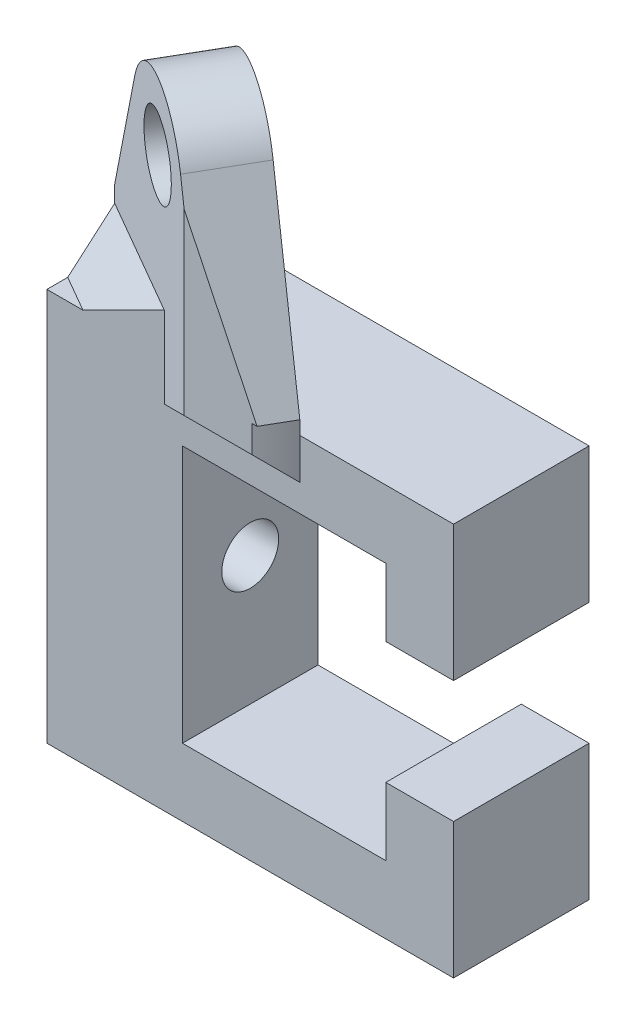
from build123d import *

# Parameters (mm, degrees)
BOSS_EXTRUDE1_DEPTH = 5
SKETCH2_R           = 2.1
CUT_EXTRUDE1_DEPTH  = 10
SKETCH3_R           = 10
BOSS_EXTRUDE2_DEPTH = 1
SKETCH4_R           = 2.75
BOSS_EXTRUDE3_DEPTH = 5
SKETCH5_W           = 50
SKETCH5_H           = 30
SKETCH5_W_2         = 34
SKETCH5_H_2         = 14
CUT_EXTRUDE2_DEPTH  = 52.14684741
CUT_EXTRUDE3_START  = -1
CUT_EXTRUDE3_DEPTH  = 1
CUT_EXTRUDE4_START  = -1
CUT_EXTRUDE4_DEPTH  = 1
CHAMFER1_SIZE       = 3
CHAMFER2_SIZE       = 3
SKETCH8_W           = 10.980685111
SKETCH8_H           = 18.946061275
CUT_EXTRUDE5_DEPTH  = 51.645829048
BOSS_EXTRUDE4_DEPTH = 1


with BuildPart() as part:
    # Sketch1 → Boss-Extrude1 (new, symmetric)
    with BuildSketch(Plane.XY):
        Polygon((15, 5), (15, 0), (0, 0), (0, 19), (15, 19), (15, 14), (20, 14), (20, 24), (-10, 24), (-10, -5), (20, -5), (20, 5), align=None)
    extrude(amount=BOSS_EXTRUDE1_DEPTH, both=True)

    # Sketch2 → Cut-Extrude1 (cut)
    with BuildSketch(Plane.ZY.offset(10)):
        with Locations(Location((0, 9.5, 0), (0, 0, 270))):
            Circle(SKETCH2_R)
    extrude(amount=-CUT_EXTRUDE1_DEPTH, mode=Mode.SUBTRACT)

    # Sketch3 → Boss-Extrude2 (add)
    with BuildSketch(Plane(origin=(0, 24, 0), x_dir=(1, 0, 0), z_dir=(0, 1, 0))):
        with Locations(Location((0, 0, 0), (0, 0, 180))):
            Circle(SKETCH3_R)
    extrude(amount=BOSS_EXTRUDE2_DEPTH)

    # Sketch4 → Boss-Extrude3 (add)
    with BuildSketch(Plane(origin=(0, 0, 0), x_dir=(0.866025403784438, 0, 0.500000000000001), z_dir=(-0.500000000000001, 0, 0.866025403784438))):
        with BuildLine():
            Line((10, 25), (-10, 25))
            Line((-10, 25), (-4.615384615, 37.923076923))
            ThreePointArc((-4.615384615, 37.923076923), (0, 41), (4.615384615, 37.923076923))
            Line((4.615384615, 37.923076923), (10, 25))
        make_face()
        with Locations((0, 36)):
            Circle(SKETCH4_R, mode=Mode.SUBTRACT)
    extrude(amount=BOSS_EXTRUDE3_DEPTH)

    # Sketch5 → Cut-Extrude2 (cut, through all)
    with BuildSketch(Plane.XZ.offset(5)):
        with Locations((5, 0)):
            Rectangle(SKETCH5_W, SKETCH5_H)
        with Locations((5, 0)):
            Rectangle(SKETCH5_W_2, SKETCH5_H_2, mode=Mode.SUBTRACT)
    extrude(amount=-CUT_EXTRUDE2_DEPTH, mode=Mode.SUBTRACT)

    # Sketch6 → Cut-Extrude3 (cut)
    with BuildSketch(Plane(origin=(0, 25, 0), x_dir=(1, 0, 0), z_dir=(0, 1, 0)).offset(CUT_EXTRUDE3_START)):
        with BuildLine():
            Line((7.141428429, 7), (-7.141428429, 7))
            ThreePointArc((-7.141428429, 7), (-7.963874195, 6.047868038), (-8.660254038, 5))
            Line((-8.660254038, 5), (8.660254038, -5))
            ThreePointArc((8.660254038, -5), (9.920851384, 1.255670262), (7.141428429, 7))
        make_face()
    extrude(amount=CUT_EXTRUDE3_DEPTH, mode=Mode.SUBTRACT)

    # Sketch7 → Cut-Extrude4 (cut)
    with BuildSketch(Plane(origin=(0, 25, 0), x_dir=(1, 0, 0), z_dir=(0, 1, 0)).offset(CUT_EXTRUDE4_START)):
        with BuildLine():
            Line((-7.141428429, -7), (2.124355653, -7))
            Line((2.124355653, -7), (-10, 0))
            ThreePointArc((-10, 0), (-9.257815193, -3.780589618), (-7.141428429, -7))
        make_face()
    extrude(amount=CUT_EXTRUDE4_DEPTH, mode=Mode.SUBTRACT)

    # Chamfer1
    # the kernel refuses this chamfer: 3 mm, written as the material it adds along each edge
    with BuildSketch(Plane(origin=(5.341682432, 24, 8.857524482), x_dir=(0.013747938305293134, 0.9996219169112968, -0.023812127644090214), z_dir=(-0.8660254037844382, 0, -0.500000000000001))) as chamfer1_piece_1_section:
        Polygon((CHAMFER1_SIZE * 0.999621916911, -CHAMFER1_SIZE * 0.0274958766106), (-CHAMFER1_SIZE * 0.0274958766106, -CHAMFER1_SIZE * 0.999621916911), (0, 0), align=None)
    chamfer1_piece_1 = extrude(amount=25.430097928, mode=Mode.PRIVATE)
    chamfer1_piece_1 = split(chamfer1_piece_1, bisect_by=Plane(origin=(-10, 25.699033003, 2.85935222), z_dir=(1, 0, 0)), keep=Keep.TOP, mode=Mode.PRIVATE)
    chamfer1_piece_1 = split(chamfer1_piece_1, bisect_by=Plane(origin=(-6.251324666, 25.699033003, 5), z_dir=(0, 0, -1)), keep=Keep.TOP, mode=Mode.PRIVATE)
    add(chamfer1_piece_1)
    with BuildSketch(Plane(origin=(5.341682432, 24, 8.857524482), x_dir=(0.013747938305293134, 0.9996219169112968, -0.023812127644090214), z_dir=(-0.8660254037844382, 0, -0.500000000000001))) as chamfer1_piece_2_section:
        Polygon((CHAMFER1_SIZE * 0.999621916911, -CHAMFER1_SIZE * 0.0274958766106), (-CHAMFER1_SIZE * 0.0274958766106, -CHAMFER1_SIZE * 0.999621916911), (0, 0), align=None)
    chamfer1_piece_2 = extrude(amount=25.430097928, mode=Mode.PRIVATE)
    chamfer1_piece_2 = split(chamfer1_piece_2, bisect_by=Plane(origin=(-10.676225886, 25, 0.518721071), z_dir=(0, 1, 0)), keep=Keep.TOP, mode=Mode.PRIVATE)
    chamfer1_piece_2 = split(chamfer1_piece_2, bisect_by=Plane(origin=(-11.252418357, 25.835555068, 0.186056192), z_dir=(0.7994080650317889, -0.38461538461538497, 0.46153846153846245)), keep=Keep.TOP, mode=Mode.PRIVATE)
    chamfer1_piece_2 = split(chamfer1_piece_2, bisect_by=Plane(origin=(-10.676225886, 25.558334336, 5), z_dir=(0, 0, -1)), keep=Keep.TOP, mode=Mode.PRIVATE)
    add(chamfer1_piece_2)

    # Chamfer2
    # the kernel refuses this chamfer: 3 mm, written as the material it adds along each edge
    with BuildSketch(Plane(origin=(16.375303002, 24, 5), x_dir=(0, -0.9996219169112968, -0.02749587661058648), z_dir=(-1, 0, 0))) as chamfer2_piece_1_section:
        Polygon((CHAMFER2_SIZE * 0.999621916911, CHAMFER2_SIZE * 0.0274958766106), (-CHAMFER2_SIZE * 0.0274958766106, CHAMFER2_SIZE * 0.999621916911), (0, 0), align=None)
    chamfer2_piece_1 = extrude(amount=25.430097928, mode=Mode.PRIVATE)
    chamfer2_piece_1 = chamfer2_piece_1 & Plane(origin=(0, 22.869371877, 0), x_dir=(-1, 0, 0), z_dir=(0, -1, 0)) * Cylinder(10, 63, mode=Mode.PRIVATE)
    chamfer2_piece_1 = split(chamfer2_piece_1, bisect_by=Plane(origin=(4.051544609, 22.869371877, 7), z_dir=(0, 0, -1)), keep=Keep.TOP, mode=Mode.PRIVATE)
    chamfer2_piece_1 = split(chamfer2_piece_1, bisect_by=Plane(origin=(3.023607395, 22.869371877, 7.519183235), z_dir=(0.500000000000001, 0, -0.8660254037844382)), keep=Keep.TOP, mode=Mode.PRIVATE)
    add(chamfer2_piece_1)

    # Sketch8 → Cut-Extrude5 (cut, through all)
    with BuildSketch(Plane.XZ.offset(5)):
        with Locations((-15.490342555, -3.686972965)):
            Rectangle(SKETCH8_W, SKETCH8_H)
    extrude(amount=-CUT_EXTRUDE5_DEPTH, mode=Mode.SUBTRACT)

    # Sketch9 → Boss-Extrude4 (add)
    with BuildSketch(Plane(origin=(0, 24, 0), x_dir=(1, 0, 0), z_dir=(0, 1, 0))):
        with BuildLine():
            Line((-8.660254038, 5), (-10, 5))
            Line((-10, 5), (-10, 0))
            ThreePointArc((-10, 0), (-9.659258263, 2.588190451), (-8.660254038, 5))
        make_face()
    extrude(amount=BOSS_EXTRUDE4_DEPTH)


solid = part.part
